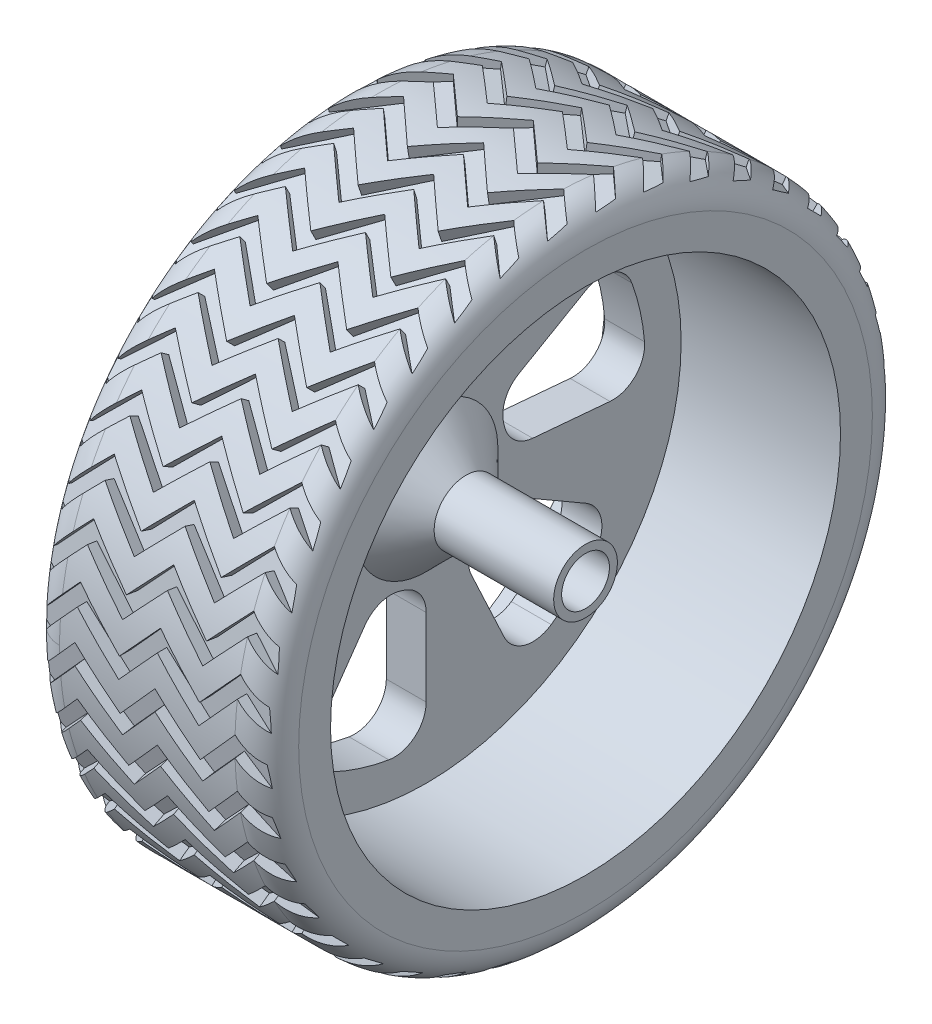
from build123d import *
from build123d.topology import SkipClean

# Parameters (mm, degrees)
CHAMFER_1_SIZE           = 5
CUT_EXTRUDE_2_DEPTH      = 10
PATTERN_CIRCULAR_1_COUNT = 6
SKETCH_13_R              = 3
CUT_EXTRUDE_3_DEPTH      = 10
CUT_EXTRUDE_4_DEPTH      = 10
PATTERN_CIRCULAR_2_COUNT = 40


with BuildPart() as part:
    # 草图1 → 旋转1 (revolve)
    with BuildSketch(Plane(origin=(0, 0, 0), x_dir=(1, 0, 0), z_dir=(0, 1, 0))):
        with BuildLine():
            Line((30, 32), (30, 36))
            ThreePointArc((30, 36), (28.828427125, 38.828427125), (26, 40))
            Line((26, 40), (4, 40))
            ThreePointArc((4, 40), (1.171572875, 38.828427125), (0, 36))
            Line((0, 36), (0, 32.427236038))
            Line((0, 32.427236038), (5, 32.427236038))
            Line((5, 32.427236038), (5, 0))
            Line((5, 0), (30, 0))
            Line((30, 0), (30, 4))
            Line((30, 4), (10, 4))
            Line((10, 4), (10, 32))
            Line((10, 32), (30, 32))
        make_face()
    revolve(axis=Axis((5, 0, 0), (1, 0, 0)))

    # 倒角1
    chamfer_1_edges = [part.edges().sort_by_distance(p)[0] for p in [
        (10, 0, 4),
    ]]
    chamfer(chamfer_1_edges, length=CHAMFER_1_SIZE)

    # 草图12 → 切除-拉伸2 (cut)
    with BuildSketch(Plane(origin=(10, 0, 0), x_dir=(0, 0, -1), z_dir=(1, 0, 0))):
        with BuildLine():
            Line((0, 23.157072354), (0, 13.416407865))
            ThreePointArc((0, 13.416407865), (0.792865097, 11.025950646), (2.857142857, 9.583148475))
            ThreePointArc((2.857142857, 9.583148475), (3.007057995, 9.537169507), (3.156233739, 9.488845482))
            ThreePointArc((3.156233739, 9.488845482), (5.674748414, 9.486698749), (7.695335412, 10.99007793))
            Line((7.695335412, 10.99007793), (13.282351037, 18.969163158))
            ThreePointArc((13.282351037, 18.969163158), (13.871245472, 22.292006484), (11.708848028, 24.88278276))
            ThreePointArc((11.708848028, 24.88278276), (8.269409486, 26.227216146), (4.680851064, 27.098701691))
            ThreePointArc((4.680851064, 27.098701691), (1.423510553, 26.216762228), (0, 23.157072354))
        make_face()
    cut_extrude_2 = extrude(amount=-CUT_EXTRUDE_2_DEPTH, mode=Mode.SUBTRACT)

    # 阵列(圆周)1: 切除-拉伸2 ×6 about axis
    pattern_circular_1_axis = Axis((30, 0, 0), (1, 0, 0))
    for i in range(1, PATTERN_CIRCULAR_1_COUNT):
        add(cut_extrude_2.rotate(pattern_circular_1_axis, i * 360 / PATTERN_CIRCULAR_1_COUNT), mode=Mode.SUBTRACT)

    # 草图13 → 切除-拉伸3 (cut)
    with BuildSketch(Plane(origin=(30, 0, 0), x_dir=(0, 0, -1), z_dir=(1, 0, 0))):
        Circle(SKETCH_13_R)
    extrude(amount=-CUT_EXTRUDE_3_DEPTH, mode=Mode.SUBTRACT)

    # 草图14 → 切除-拉伸4 (cut)
    with BuildSketch(Plane.XY.offset(38.5)):
        Polygon((31.516806261, 0), (26, 5), (21.468392614, 0), (15.947361143, 5.003829399), (11.412283091, 0), (5.917339669, 4.980185239), (1.403690828, 0), (-1.354712303, 2.5), (-1.386837811, 5), (1.37156532, 2.5), (5.903172706, 7.5), (11.419978967, 2.5), (15.951586353, 7.5), (21.468392614, 2.5), (26, 7.5), (31.516806261, 2.5), align=None)
    cut_extrude_4 = extrude(amount=CUT_EXTRUDE_4_DEPTH, mode=Mode.SUBTRACT)

    # 阵列(圆周)2: 切除-拉伸4 ×40 about axis
    with SkipClean():  # the faces are left unmerged after this step: merging them gives an invalid solid
        pattern_circular_2_axis = Axis((5, 0, 0), (-1, 0, 0))
        for i in range(1, PATTERN_CIRCULAR_2_COUNT):
            add(cut_extrude_4.rotate(pattern_circular_2_axis, i * 360 / PATTERN_CIRCULAR_2_COUNT), mode=Mode.SUBTRACT)


solid = part.part
